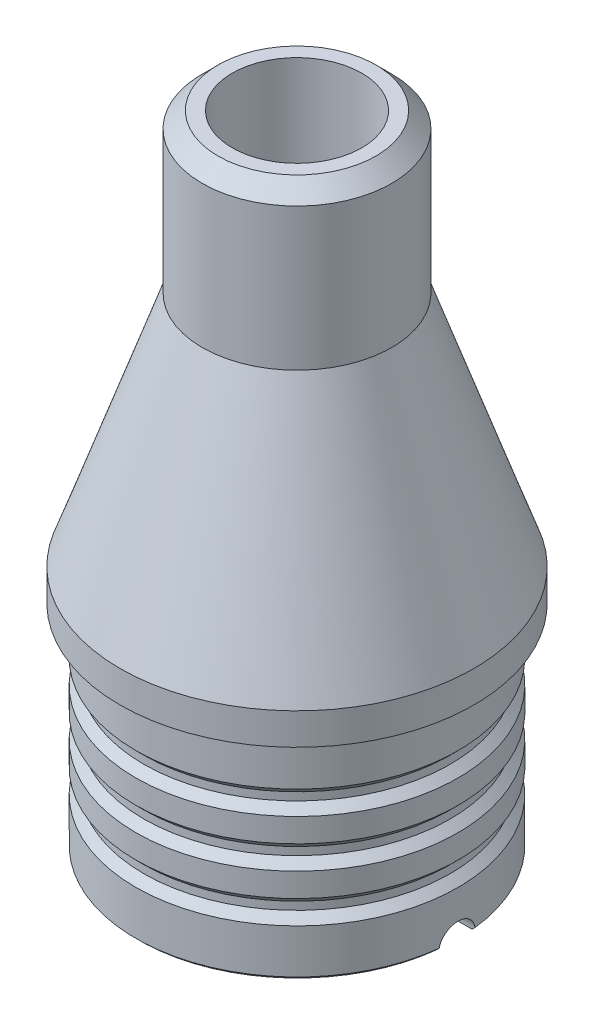
from build123d import *

# Parameters (mm, degrees)
CHAMFER_1_SIZE           = 1
SKETCH_2_R               = 1.6
CUT_EXTRUDE_1_DEPTH      = 3.2
EXTRUDE_START            = 5.5
SKETCH_3_R               = 10.2
SKETCH_3_R_2             = 8.35
EXTRUDE_1_DEPTH          = 5.5
CHAMFER_2_SIZE           = 0.5
CUT_EXTRUDE_2_DEPTH      = 39.417183655
CUT_EXTRUDE_2_DEPTH_BACK = 39.417183655
SKETCH_4_R               = 1.15


with BuildPart() as part:
    # 스케치1 → 회전1 (revolve)
    with BuildSketch(Plane(origin=(0, 0, 0), x_dir=(0, 0, -1), z_dir=(1, 0, 0))):
        Polygon((4.1, 0), (4.1, 35), (6, 35), (6, 25), (11.2, 10), (11.2, 8), (10.2, 8), (10.2, 5.7), (10.2, 4), (10.2, 0), align=None)
    revolve(axis=Axis((0, 0, 0), (0, 1, 0)))

    # 모따기1
    chamfer_1_edges = [part.edges().sort_by_distance(p)[0] for p in [
        (0, 35, 6),
    ]]
    chamfer(chamfer_1_edges, length=CHAMFER_1_SIZE)

    # 스케치2 → 컷-돌출1 (cut)
    with BuildSketch(Plane(origin=(0, 0, 0), x_dir=(1, 0, 0), z_dir=(0, 1, 0))):
        with Locations(Location((-6.3, 0, 0), (0, 0, 270))):
            Circle(SKETCH_2_R)
        with Locations(Location((6.3, 0, 0), (0, 0, 90))):
            Circle(SKETCH_2_R)
    extrude(amount=CUT_EXTRUDE_1_DEPTH, mode=Mode.SUBTRACT)

    # 스케치3 → 보스-돌출1 (add)
    with BuildSketch(Plane.XZ.offset(EXTRUDE_START)):
        with Locations(Location((0, 0, 0), (0, 0, 270))):
            Circle(SKETCH_3_R)
        with Locations(Location((0, 0, 0), (0, 0, 270))):
            Circle(SKETCH_3_R_2, mode=Mode.SUBTRACT)
    extrude(amount=-EXTRUDE_1_DEPTH)

    # 모따기2
    chamfer_2_edges = [part.edges().sort_by_distance(p)[0] for p in [
        (0, 0, 4.1),
    ]]
    chamfer(chamfer_2_edges, length=CHAMFER_2_SIZE)

    # 스케치4 → 컷-돌출2 (cut, two sides: drawn at the far end of the back side and taken through both)
    with BuildSketch(Plane(origin=(0, 0, 0), x_dir=(0, 0, -1), z_dir=(1, 0, 0)).offset(-CUT_EXTRUDE_2_DEPTH_BACK)):
        with Locations((0, -5.5)):
            Circle(SKETCH_4_R)
    extrude(amount=CUT_EXTRUDE_2_DEPTH + CUT_EXTRUDE_2_DEPTH_BACK, mode=Mode.SUBTRACT)

    # 스케치6 → 컷-회전1 (revolve, cut)
    with BuildSketch(Plane(origin=(0, 0, 0), x_dir=(0, 0, -1), z_dir=(1, 0, 0)), mode=Mode.PRIVATE) as cut_revolve_1_sk:
        Polygon((10.2, 5), (9.7, 4.5), (9.7, 4), (10.2, 3.5), (11.2, 3.5), (11.2, 5), align=None)
        Polygon((9.7, 1.5), (9.7, 1), (10.2, 0.5), (11.2, 0.5), (11.2, 2), (10.2, 2), align=None)
        Polygon((9.7, -1.5), (9.7, -2), (10.2, -2.5), (11.2, -2.5), (11.2, -1), (10.2, -1), align=None)
    revolve(cut_revolve_1_sk.sketch.rotate(Axis((0, 0, 0), (0, -1, 0)), 180), axis=Axis((0, 0, 0), (0, -1, 0)), mode=Mode.SUBTRACT)

    # 모따기3: read off the stored shape, not the designer's step
    # 모따기3 outline → 모따기3 (revolve, cut)
    with BuildSketch(Plane.XY):
        Polygon((10.2, -5.3), (10, -5.5), (10.2, -5.5), align=None)
    revolve(axis=Axis((0, 0, 0), (0, 1, 0)), mode=Mode.SUBTRACT)


solid = part.part
